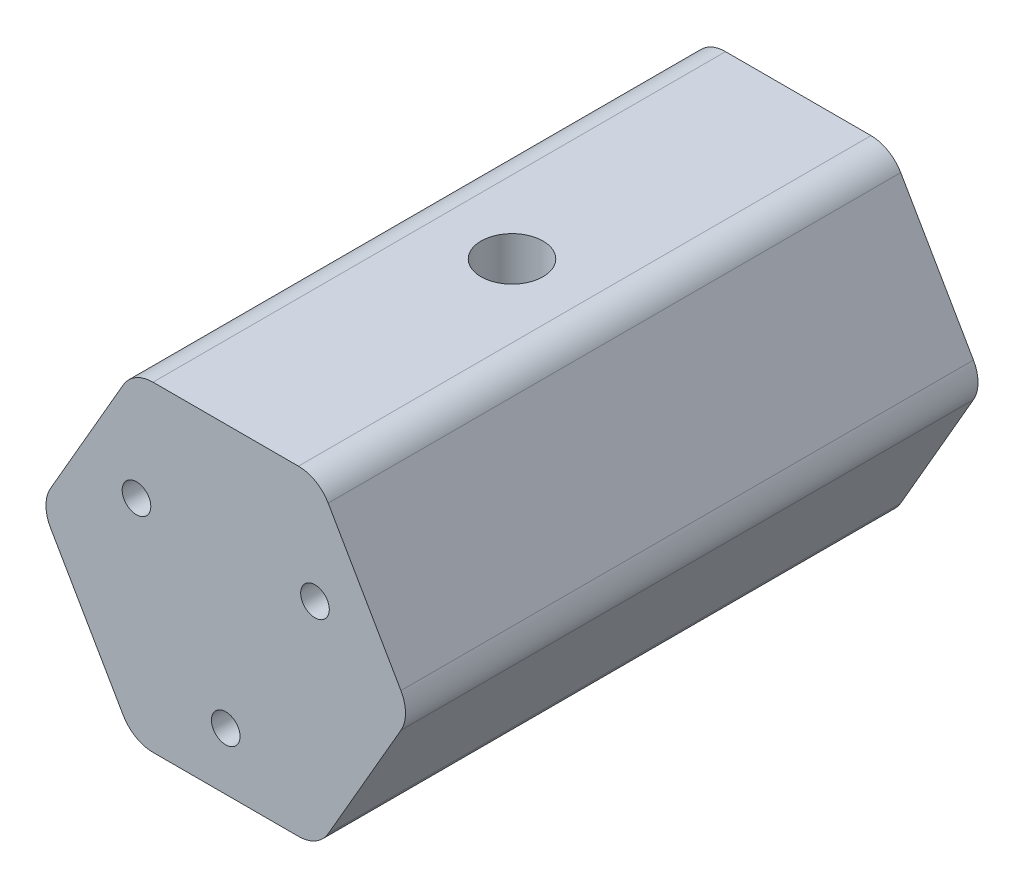
from build123d import *

# Parameters (mm, degrees)
SKETCH1_R               = 1.25
BOSS_EXTRUDE1_DEPTH     = 50
F_1_4_28_TAPPED_HOLE1_D = 5.4102


with BuildPart() as part:
    # Sketch1 → Boss-Extrude1 (new body)
    with BuildSketch(Plane.XY):
        with BuildLine():
            Line((-6.350852961, -14), (6.350852961, -14))
            ThreePointArc((6.350852961, -14), (7.850852961, -13.598076211), (8.948929172, -12.5))
            Line((8.948929172, -12.5), (15.299782134, -1.5))
            ThreePointArc((15.299782134, -1.5), (15.701705922, 0), (15.299782134, 1.5))
            Line((15.299782134, 1.5), (8.948929172, 12.5))
            ThreePointArc((8.948929172, 12.5), (7.850852961, 13.598076211), (6.350852961, 14))
            Line((6.350852961, 14), (-6.350852961, 14))
            ThreePointArc((-6.350852961, 14), (-7.850852961, 13.598076211), (-8.948929172, 12.5))
            Line((-8.948929172, 12.5), (-15.299782134, 1.5))
            ThreePointArc((-15.299782134, 1.5), (-15.701705922, 0), (-15.299782134, -1.5))
            Line((-15.299782134, -1.5), (-8.948929172, -12.5))
            ThreePointArc((-8.948929172, -12.5), (-7.850852961, -13.598076211), (-6.350852961, -14))
        make_face()
        with Locations((-7.794228634, 4.5)):
            Circle(SKETCH1_R, mode=Mode.SUBTRACT)
        with Locations((7.794228634, 4.5)):
            Circle(SKETCH1_R, mode=Mode.SUBTRACT)
        with Locations((0, -9)):
            Circle(SKETCH1_R, mode=Mode.SUBTRACT)
    extrude(amount=BOSS_EXTRUDE1_DEPTH)

    # 1/4-28 Tapped Hole1 (through all)
    with Locations(Plane(origin=(0, 14, 0), x_dir=(1, 0, 0), z_dir=(0, 1, 0))):
        with Locations((0, -25)):
            Hole(F_1_4_28_TAPPED_HOLE1_D / 2)


solid = part.part
